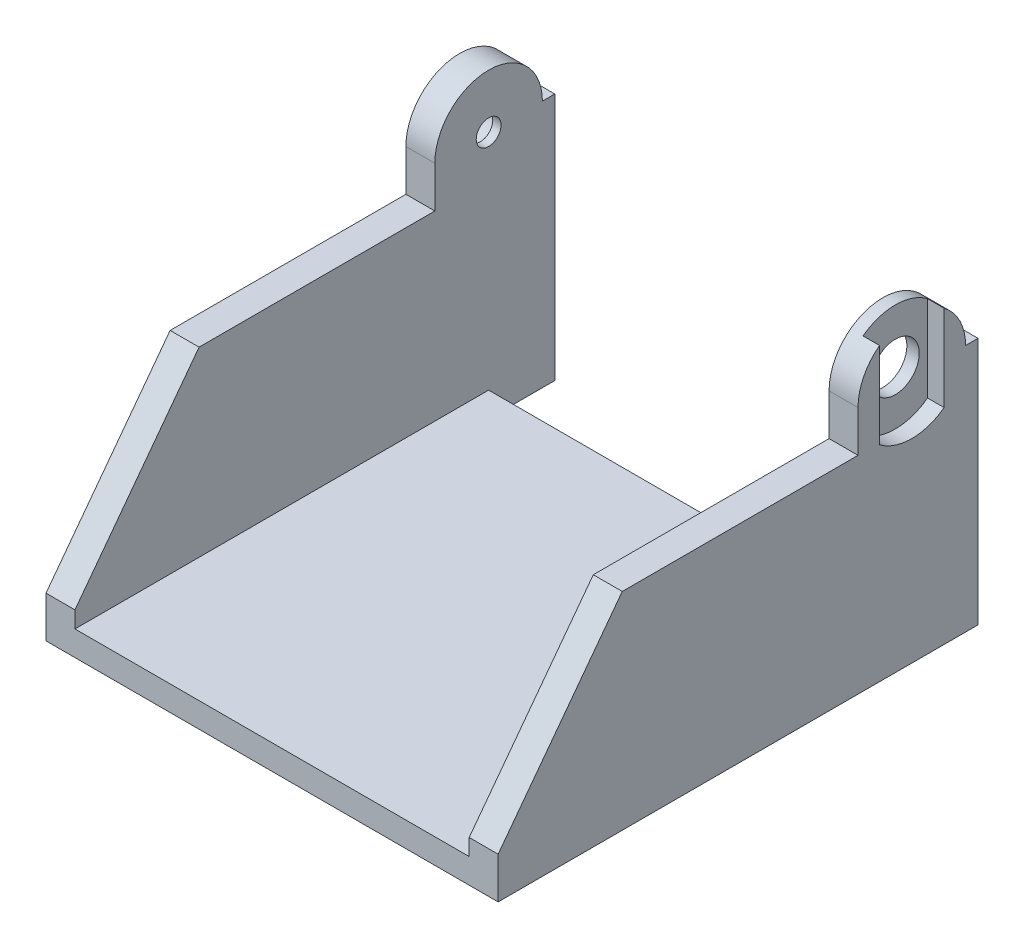
from build123d import *
from build123d.topology import SkipClean

# Parameters (mm, degrees)
BOSS_EXTRUDE1_DEPTH     = 50
BOSS_EXTRUDE2_DEPTH     = 3.5
SKETCH3_R               = 1.5
CUT_EXTRUDE1_DEPTH      = 65.394531018
CUT_EXTRUDE2_DEPTH      = 80.916346888
CUT_EXTRUDE2_DEPTH_BACK = 3.15
SKETCH4_R               = 2.5
SKETCH5_R               = 2.9
CUT_EXTRUDE3_DEPTH      = 7.15
CUT_EXTRUDE4_DEPTH      = 7.15
SKETCH7_R               = 2.5
SKETCH7_R_2             = 1.5
BOSS_EXTRUDE3_DEPTH     = 0.65
SKETCH8_R               = 2.9
CUT_EXTRUDE6_DEPTH      = 2


with BuildPart() as part:
    # Sketch1 → Boss-Extrude1 (new body)
    with BuildSketch(Plane.XY):
        Polygon((-23.825, -27), (-23.825, 0), (-27.325, 0), (-27.325, -30), (0, -30), (0, -27), align=None)
    boss_extrude1 = extrude(amount=BOSS_EXTRUDE1_DEPTH)

    # Sketch2 → Boss-Extrude2 (add)
    with BuildSketch(Plane(origin=(-23.825, 0, 0), x_dir=(0, 0, -1), z_dir=(1, 0, 0))):
        with BuildLine():
            ThreePointArc((-1.5, 0), (1.060660172, 1.060660172), (0, -1.5))
            Line((0, -1.5), (0, -30))
            Line((0, -30), (8, -30))
            Line((8, -30), (8, 0))
            Line((8, 0), (6.5, 0))
            ThreePointArc((6.5, 0), (0, 6.5), (-6.5, 0))
            Line((-6.5, 0), (-1.5, 0))
        make_face()
    boss_extrude2 = extrude(amount=-BOSS_EXTRUDE2_DEPTH)

    # Sketch3 → Cut-Extrude1 (cut, symmetric)
    with BuildSketch(Plane.ZY.offset(27.325)):
        Circle(SKETCH3_R)
    cut_extrude1 = extrude(amount=CUT_EXTRUDE1_DEPTH, both=True, mode=Mode.SUBTRACT)

    # Mirror1: Boss-Extrude1, Boss-Extrude2, Cut-Extrude1 across plane
    with SkipClean():  # the faces are left unmerged after this step: merging them gives an invalid solid
        add(boss_extrude1.mirror(Plane(origin=(0, 0, 50), x_dir=(0, 0, 1), z_dir=(-1, 0, 0))))
        add(boss_extrude2.mirror(Plane(origin=(0, 0, 50), x_dir=(0, 0, 1), z_dir=(-1, 0, 0))))
        add(cut_extrude1.mirror(Plane(origin=(0, 0, 50), x_dir=(0, 0, 1), z_dir=(-1, 0, 0))), mode=Mode.SUBTRACT)

    # Sketch4 → Cut-Extrude2 (cut, two sides: drawn at the far end of the back side and taken through both)
    with SkipClean():  # the faces are left unmerged after this step: merging them gives an invalid solid
        with BuildSketch(Plane.ZY.offset(27.325).offset(-CUT_EXTRUDE2_DEPTH_BACK)):
            Circle(SKETCH4_R)
        extrude(amount=CUT_EXTRUDE2_DEPTH + CUT_EXTRUDE2_DEPTH_BACK, mode=Mode.SUBTRACT)

    # Sketch5 → Cut-Extrude3 (cut)
    with BuildSketch(Plane(origin=(27.325, 0, 0), x_dir=(0, 0, -1), z_dir=(1, 0, 0))):
        Circle(SKETCH5_R)
    extrude(amount=-CUT_EXTRUDE3_DEPTH, mode=Mode.SUBTRACT)

    # Sketch6 → Cut-Extrude4 (cut)
    with BuildSketch(Plane.ZY.offset(27.325)):
        Polygon((50, -10), (50, 0), (25, 0), (6.5, 0), (6.5, -5), (35, -5), (50, -25), align=None)
    cut_extrude4 = extrude(amount=-CUT_EXTRUDE4_DEPTH, mode=Mode.SUBTRACT)

    # Mirror2: Cut-Extrude4 across plane
    add(cut_extrude4.mirror(Plane(origin=(0, 0, 0), x_dir=(0, 0, 1), z_dir=(1, 0, 0))), mode=Mode.SUBTRACT)

    # Sketch7 → Boss-Extrude3 (add)
    with BuildSketch(Plane.ZY.offset(24.175)):
        Circle(SKETCH7_R)
        Circle(SKETCH7_R_2, mode=Mode.SUBTRACT)
    extrude(amount=BOSS_EXTRUDE3_DEPTH)

    # Sketch8 → Cut-Extrude6 (cut)
    with BuildSketch(Plane(origin=(27.325, 0, 0), x_dir=(0, 0, -1), z_dir=(1, 0, 0))):
        with BuildLine():
            ThreePointArc((3.9, 5.2), (0, 6.5), (-3.9, 5.2))
            Line((-3.9, 5.2), (-3.9, -5.2))
            ThreePointArc((-3.9, -5.2), (0, -6.5), (3.9, -5.2))
            Line((3.9, -5.2), (3.9, 5.2))
        make_face()
        Circle(SKETCH8_R, mode=Mode.SUBTRACT)
    extrude(amount=-CUT_EXTRUDE6_DEPTH, mode=Mode.SUBTRACT)


solid = part.part
